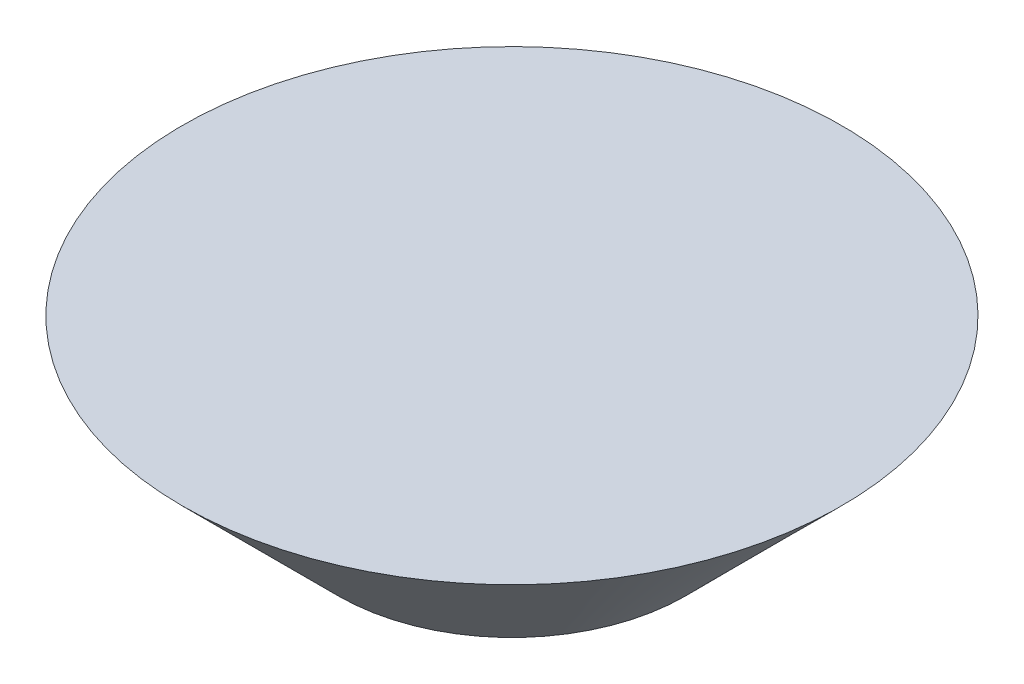
from build123d import *

# Parameters (mm, degrees)
SZKIC1_R                    = 76
DODANIE_WYCI_GNI_CIE1_DEPTH = 36
SFAZOWANIE1_SIZE            = 36


with BuildPart() as part:
    # Szkic1 → Dodanie-wyciągnięcie1 (new body)
    with BuildSketch(Plane(origin=(0, 0, 0), x_dir=(1, 0, 0), z_dir=(0, 1, 0))):
        with Locations(Location((0, 0, 0), (0, 0, 270))):
            Circle(SZKIC1_R)
    extrude(amount=DODANIE_WYCI_GNI_CIE1_DEPTH)

    # Sfazowanie1
    sfazowanie1_edges = [part.edges().sort_by_distance(p)[0] for p in [
        (0, 0, -76),
    ]]
    chamfer(sfazowanie1_edges, length=SFAZOWANIE1_SIZE - 0.0001)  # a hair under: the kernel refuses the full size


solid = part.part
